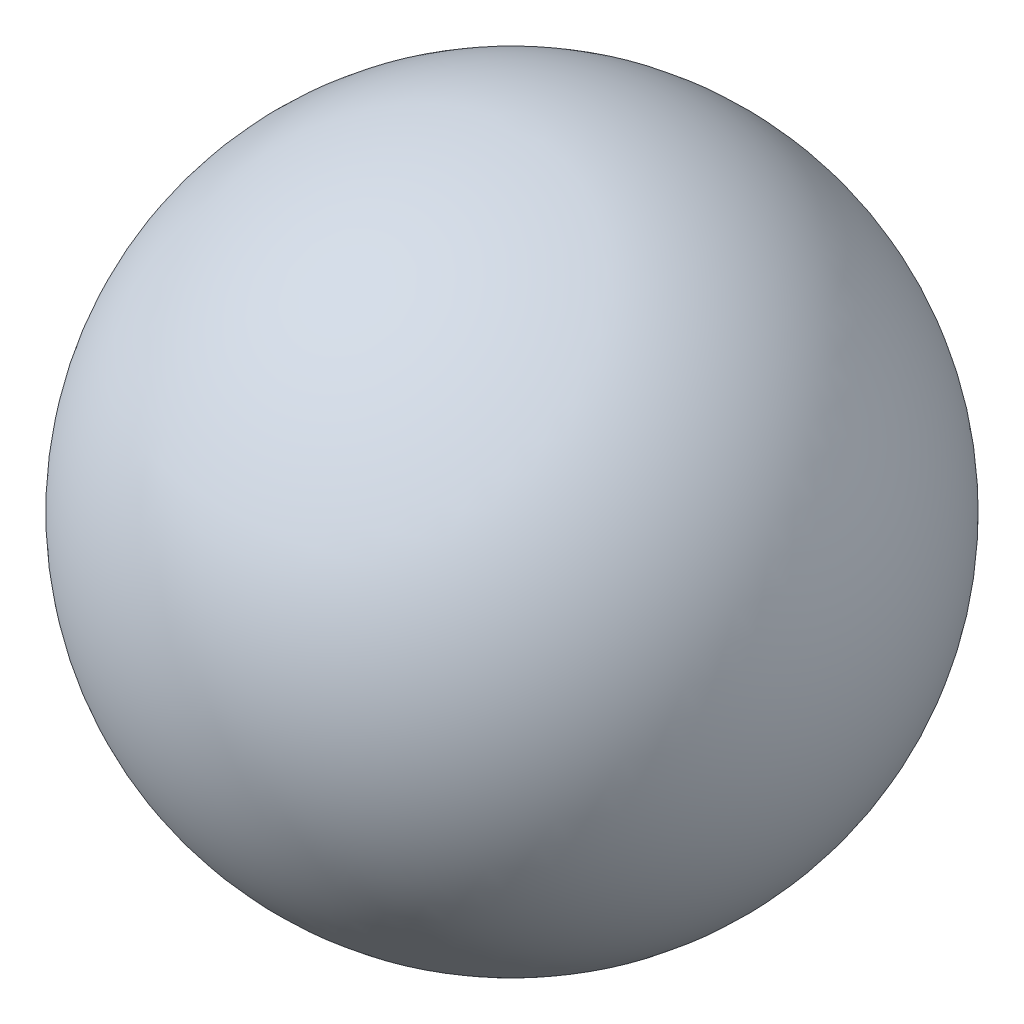
from build123d import *


with BuildPart() as part:
    # Sketch1 → Revolve1 (revolve)
    with BuildSketch(Plane.XY):
        with BuildLine():
            ThreePointArc((0, 127), (-127, 0), (0, -127))
            Line((0, -127), (0, 127))
        make_face()
    revolve(axis=Axis((0, -127, 0), (0, 1, 0)))


solid = part.part
